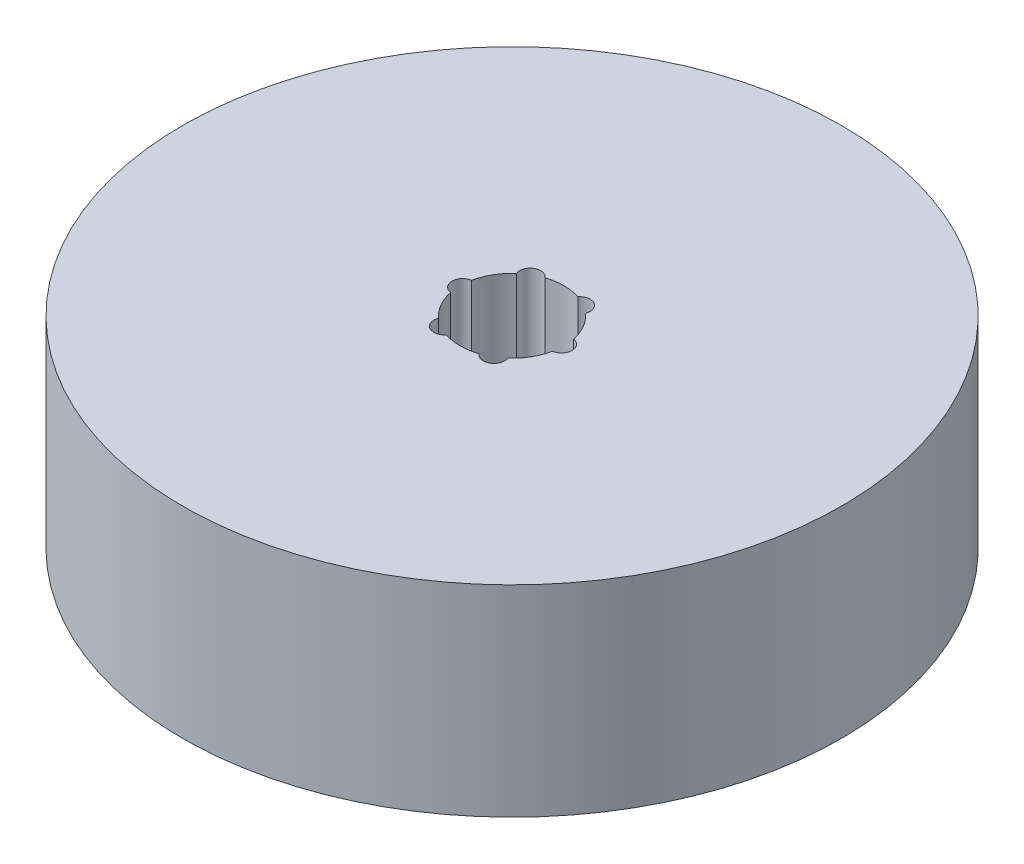
from build123d import *

# Parameters (mm, degrees)
SKETCH1_R           = 47.5
BOSS_EXTRUDE1_DEPTH = 29
SKETCH2_R           = 7.5
CUT_EXTRUDE1_DEPTH  = 74.167615787
SKETCH3_R           = 1.533548882
CUT_EXTRUDE2_DEPTH  = 26.517871126
CIRPATTERN1_COUNT   = 6


with BuildPart() as part:
    # Sketch1 → Boss-Extrude1 (new body)
    with BuildSketch(Plane(origin=(0, 0, 0), x_dir=(1, 0, 0), z_dir=(0, 1, 0))):
        Circle(SKETCH1_R)
    extrude(amount=BOSS_EXTRUDE1_DEPTH)

    # Sketch2 → Cut-Extrude1 (cut, through all)
    with BuildSketch(Plane(origin=(0, 0, 0), x_dir=(1, 0, 0), z_dir=(0, 1, 0))):
        Circle(SKETCH2_R)
    extrude(amount=CUT_EXTRUDE1_DEPTH, mode=Mode.SUBTRACT)

    # Sketch3 → Cut-Extrude2 (cut)
    with BuildSketch(Plane(origin=(0, 29, 0), x_dir=(1, 0, 0), z_dir=(0, 1, 0))):
        with Locations((-7.124914208, 0)):
            Circle(SKETCH3_R)
    cut_extrude2 = extrude(amount=-CUT_EXTRUDE2_DEPTH, mode=Mode.SUBTRACT)

    # CirPattern1: Cut-Extrude2 ×6 about axis
    cirpattern1_axis = Axis((0, 0, 0), (0, 1, 0))
    for i in range(1, CIRPATTERN1_COUNT):
        add(cut_extrude2.rotate(cirpattern1_axis, i * 360 / CIRPATTERN1_COUNT), mode=Mode.SUBTRACT)


solid = part.part
